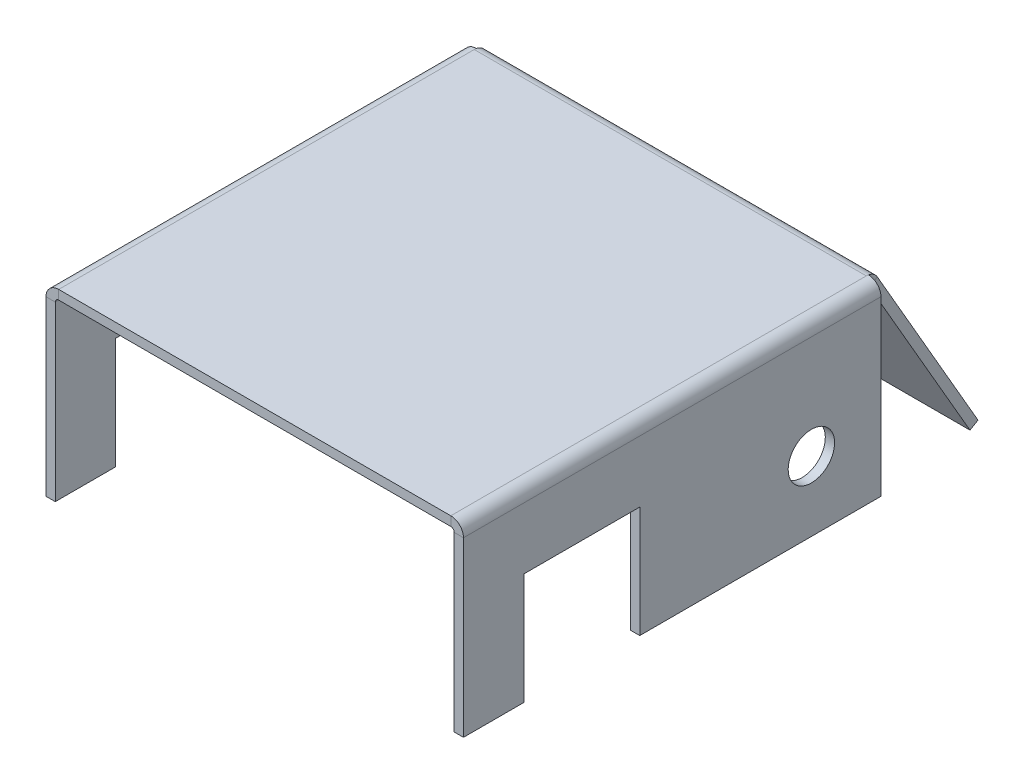
from build123d import *

# Parameters (mm, degrees)
SKETCH1_W                    = 90
SKETCH1_H                    = 90
BASE_FLANGE1_DEPTH           = 2
EDGE_FLANGE1_STRIP_W         = 9.4732
EDGE_FLANGE1_STRIP_H         = 2
EDGE_FLANGE1_STRIP_CUT_DEPTH = 90
EDGE_FLANGE1_DEPTH           = 90
EDGE_FLANGE3_STRIP_W         = 9.4732
EDGE_FLANGE3_STRIP_H         = 2
EDGE_FLANGE3_STRIP_CUT_DEPTH = 90
EDGE_FLANGE3_DEPTH           = 90
EDGE_FLANGE5_STRIP_CUT_DEPTH = 84.5268
EDGE_FLANGE5_DEPTH           = 84.5268
SKETCH25_W                   = 25
SKETCH25_H                   = 24
CUT_EXTRUDE1_DEPTH           = 119.937769086
SKETCH26_R                   = 5
CUT_EXTRUDE2_DEPTH           = 119.937769086


# Sheet-metal steps are written as plain solids
with BuildPart() as part:
    # Sketch1 → Base-Flange1 (new body)
    with BuildSketch(Plane(origin=(0, 0, 0), x_dir=(1, 0, 0), z_dir=(0, 1, 0))):
        with Locations((2.680250784, -1.97492163)):
            Rectangle(SKETCH1_W, SKETCH1_H)
    extrude(amount=-BASE_FLANGE1_DEPTH)

    # Edge-Flange1 strip (across the edge) → Edge-Flange1 strip cut (cut)
    with BuildSketch(Plane(origin=(-42.319749216, -2, 46.97492163), x_dir=(1, 0, 0), z_dir=(0, 0, -1))):
        with Locations((-2, -1)):
            Rectangle(EDGE_FLANGE1_STRIP_W, EDGE_FLANGE1_STRIP_H)
    extrude(amount=EDGE_FLANGE1_STRIP_CUT_DEPTH, mode=Mode.SUBTRACT)

    # Edge-Flange1 section (across the edge) → Edge-Flange1 (add)
    with BuildSketch(Plane(origin=(-42.319749216, -2, 46.97492163), x_dir=(1, 0, 0), z_dir=(0, 0, -1))):
        with BuildLine():
            Line((0, 0.7366), (0, 38))
            Line((0, 38), (2, 38))
            Line((2, 38), (2, 0.7366))
            ThreePointArc((2, 0.7366), (2.215745145, 0.215745145), (2.7366, 0))
            Line((2.7366, 0), (2.7366, -2))
            ThreePointArc((2.7366, -2), (0.801531583, -1.198468417), (0, 0.7366))
        make_face()
    extrude(amount=EDGE_FLANGE1_DEPTH)

    # Edge-Flange3 strip (across the edge) → Edge-Flange3 strip cut (cut)
    with BuildSketch(Plane(origin=(47.680250784, -2, -43.02507837), x_dir=(-1, 0, 0), z_dir=(0, 0, 1))):
        with Locations((-2, -1)):
            Rectangle(EDGE_FLANGE3_STRIP_W, EDGE_FLANGE3_STRIP_H)
    extrude(amount=EDGE_FLANGE3_STRIP_CUT_DEPTH, mode=Mode.SUBTRACT)

    # Edge-Flange3 section (across the edge) → Edge-Flange3 (add)
    with BuildSketch(Plane(origin=(47.680250784, -2, -43.02507837), x_dir=(-1, 0, 0), z_dir=(0, 0, 1))):
        with BuildLine():
            Line((0, 0.7366), (0, 38))
            Line((0, 38), (2, 38))
            Line((2, 38), (2, 0.7366))
            ThreePointArc((2, 0.7366), (2.215745145, 0.215745145), (2.7366, 0))
            Line((2.7366, 0), (2.7366, -2))
            ThreePointArc((2.7366, -2), (0.801531583, -1.198468417), (0, 0.7366))
        make_face()
    extrude(amount=EDGE_FLANGE3_DEPTH)

    # Edge-Flange5 strip (across the edge) → Edge-Flange5 strip cut (cut)
    with BuildSketch(Plane(origin=(-39.583149216, -2, -43.02507837), x_dir=(0, -0.5000000000000041, 0.8660254037844364), z_dir=(1, 0, 0))):
        Polygon((-8.835731855, 2.791911088), (-0.6317, -1.944688912), (0.3683, -0.212638104), (-7.835731855, 4.523961896), align=None)
    extrude(amount=EDGE_FLANGE5_STRIP_CUT_DEPTH, mode=Mode.SUBTRACT)

    # Edge-Flange5 section (across the edge) → Edge-Flange5 (add)
    with BuildSketch(Plane(origin=(-39.583149216, -2, -43.02507837), x_dir=(0, -0.5000000000000041, 0.8660254037844364), z_dir=(1, 0, 0))):
        with BuildLine():
            Line((-2, 0.425276208), (-2, 43.845299462))
            Line((-2, 43.845299462), (0, 43.845299462))
            Line((0, 43.845299462), (0, 0.425276208))
            ThreePointArc((0, 0.425276208), (0.098685688, 0.056976208), (0.3683, -0.212638104))
            Line((0.3683, -0.212638104), (-0.6317, -1.944688912))
            ThreePointArc((-0.6317, -1.944688912), (-1.63336512, -0.943023792), (-2, 0.425276208))
        make_face()
    extrude(amount=EDGE_FLANGE5_DEPTH)

    # Sketch25 → Cut-Extrude1 (cut, through all)
    with BuildSketch(Plane(origin=(47.680250784, 0, 0), x_dir=(0, 0, -1), z_dir=(1, 0, 0))):
        with Locations((-21.47492163, -28)):
            Rectangle(SKETCH25_W, SKETCH25_H)
    extrude(amount=-CUT_EXTRUDE1_DEPTH, mode=Mode.SUBTRACT)

    # Sketch26 → Cut-Extrude2 (cut, through all)
    with BuildSketch(Plane.ZY.offset(42.319749216)):
        with Locations(Location((-28.02507837, -25, 0), (0, 0, 270))):
            Circle(SKETCH26_R)
    extrude(amount=-CUT_EXTRUDE2_DEPTH, mode=Mode.SUBTRACT)


solid = part.part
